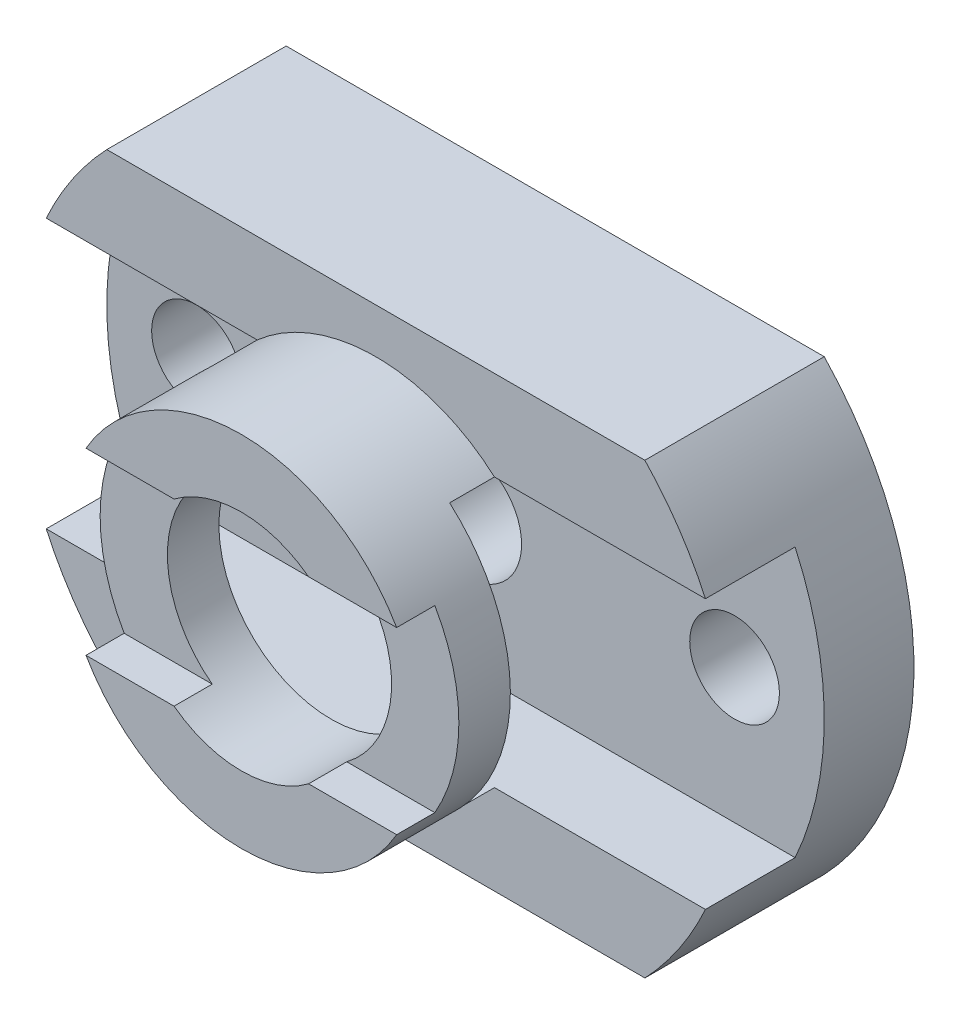
from build123d import *

# Parameters (mm, degrees)
BOSS_EXTRUDE1_DEPTH      = 8
SKETCH2_W                = 3
SKETCH2_H                = 6
CUT_EXTRUDE1_DEPTH       = 16
CUT_EXTRUDE2_START       = -7
CUT_EXTRUDE2_OUTLINE_R   = 1
CUT_EXTRUDE2_OUTLINE_R_2 = 1.25
CUT_EXTRUDE2_DEPTH       = 7
SKETCH4_R                = 11.300905521
SKETCH4_R_2              = 4
CUT_EXTRUDE3_DEPTH       = 3
SKETCH5_W                = 0.851480407
SKETCH5_H                = 4
CUT_EXTRUDE4_DEPTH       = 8
CUT_EXTRUDE5_DEPTH       = 1
CUT_EXTRUDE5_DEPTH_BACK  = 2
SKETCH6_R                = 2.5


# Read off the part's stored shape, not the designer's step: Cut-Extrude2
with BuildPart() as part:
    # Sketch1 → Boss-Extrude1 (new, symmetric)
    with BuildSketch(Plane(origin=(0, 0, 0), x_dir=(0, 0, -1), z_dir=(1, 0, 0))):
        Polygon((0, -5), (0, 5), (-4, 5), (-4, 4), (-7, 4), (-7, -4), (-4, -4), (-4, -5), align=None)
    extrude(amount=BOSS_EXTRUDE1_DEPTH, both=True)

    # Sketch2 → Cut-Extrude1 (cut)
    with BuildSketch(Plane.ZY.offset(8)):
        with Locations((3.5, 0)):
            Rectangle(SKETCH2_W, SKETCH2_H)
    extrude(amount=-CUT_EXTRUDE1_DEPTH, mode=Mode.SUBTRACT)

    # Cut-Extrude2 outline → Cut-Extrude2 (cut)
    with BuildSketch(Plane.XY.offset(7).offset(CUT_EXTRUDE2_START)):
        with BuildLine():
            ThreePointArc((-8.000004764, 0), (-7.481459456, 2.692583288), (-6, 5))
            Line((-6, 5), (-8, 5))
            Line((-8, 5), (-8.000004764, 0))
        make_face()
        with BuildLine():
            ThreePointArc((-6, -5), (-7.481459456, -2.692583288), (-8.000004764, 0))
            Line((-8.000004764, 0), (-8, -5))
            Line((-8, -5), (-6, -5))
        make_face()
        with BuildLine():
            Line((8, 5), (6, 5))
            ThreePointArc((6, 5), (7.481456009, 2.692582404), (8, 0))
            Line((8, 0), (8, 5))
        make_face()
        with BuildLine():
            Line((8, -5), (8, 0))
            ThreePointArc((8, 0), (7.481456009, -2.692582404), (6, -5))
            Line((6, -5), (8, -5))
        make_face()
        with Locations((-6, 0)):
            Circle(CUT_EXTRUDE2_OUTLINE_R)
        Circle(CUT_EXTRUDE2_OUTLINE_R_2)
        with Locations((6, 0)):
            Circle(CUT_EXTRUDE2_OUTLINE_R)
    extrude(amount=CUT_EXTRUDE2_DEPTH, mode=Mode.SUBTRACT)

    # Sketch4 → Cut-Extrude3 (cut)
    with BuildSketch(Plane.XY.offset(7)):
        Circle(SKETCH4_R)
        Circle(SKETCH4_R_2, mode=Mode.SUBTRACT)
    extrude(amount=-CUT_EXTRUDE3_DEPTH, mode=Mode.SUBTRACT)

    # Sketch5 → Cut-Extrude4 (cut, symmetric)
    with BuildSketch(Plane(origin=(0, 0, 0), x_dir=(0, 0, -1), z_dir=(1, 0, 0))):
        with Locations((-6.574259796, 0)):
            Rectangle(SKETCH5_W, SKETCH5_H)
    extrude(amount=CUT_EXTRUDE4_DEPTH, both=True, mode=Mode.SUBTRACT)

    # Sketch6 → Cut-Extrude5 (cut, two sides: drawn at the far end of the back side and taken through both)
    with BuildSketch(Plane.XY.offset(6.148519593).offset(-CUT_EXTRUDE5_DEPTH_BACK)):
        with Locations(Location((0, 0, 0), (0, 0, 233.130102354))):
            Circle(SKETCH6_R)
    extrude(amount=CUT_EXTRUDE5_DEPTH + CUT_EXTRUDE5_DEPTH_BACK, mode=Mode.SUBTRACT)


solid = part.part
